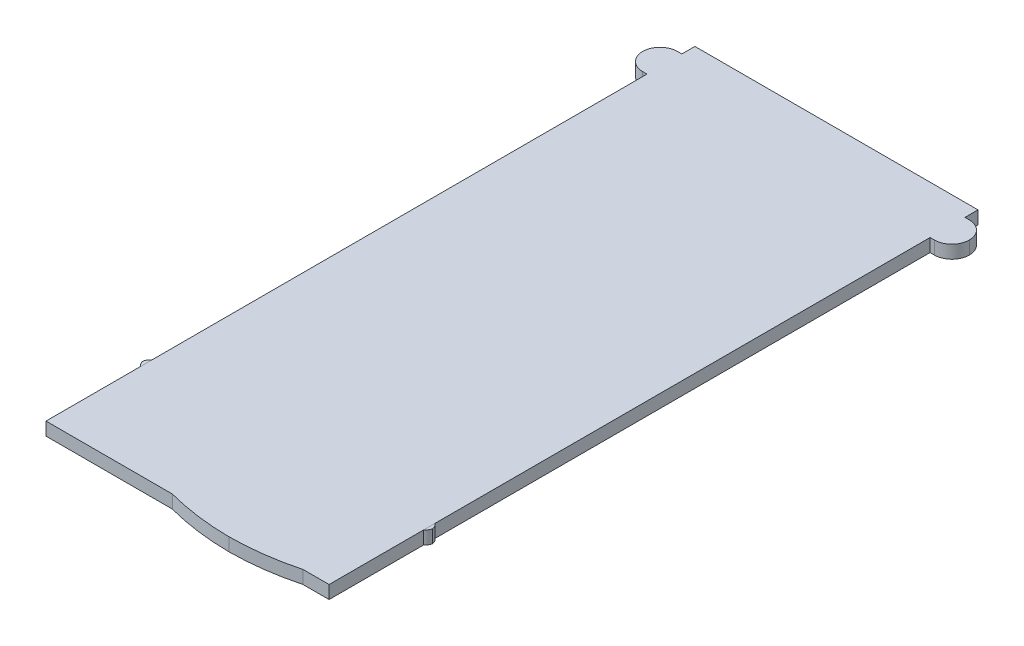
from build123d import *

# Parameters (mm, degrees)
CROQUIS1_W               = 65
CROQUIS1_H               = 146
SALIENTE_EXTRUIR1_DEPTH  = 3
CROQUIS2_W               = 8
CROQUIS2_H               = 3
SALIENTE_EXTRUIR2_DEPTH  = 5
REDONDEO1_R              = 4
REDONDEO1_OF_SIMETR_A1_R = 4
CROQUIS3_W               = 2.60095456
CROQUIS3_H               = 3.001101416
SALIENTE_EXTRUIR3_DEPTH  = 0.8
REDONDEO2_R              = 2
REDONDEO2_OF_SIMETR_A5_R = 2
CROQUIS4_W               = 65
CROQUIS4_H               = 3
CROQUIS4_W_2             = 30
CROQUIS4_H_2             = 2
SALIENTE_EXTRUIR4_DEPTH  = 3
REDONDEO3_R              = 60


# Some blends are built 0.0001 mm under size
with BuildPart() as part:
    # Croquis1 → Saliente-Extruir1 (new body)
    with BuildSketch(Plane(origin=(0, 0, 0), x_dir=(1, 0, 0), z_dir=(0, 1, 0))):
        Rectangle(CROQUIS1_W, CROQUIS1_H)
    extrude(amount=SALIENTE_EXTRUIR1_DEPTH)

    # Croquis2 → Saliente-Extruir2 (add)
    with BuildSketch(Plane(origin=(32.5, 0, 0), x_dir=(0, 0, -1), z_dir=(1, 0, 0))):
        with Locations((66, 1.5)):
            Rectangle(CROQUIS2_W, CROQUIS2_H)
    saliente_extruir2 = extrude(amount=SALIENTE_EXTRUIR2_DEPTH)

    # Redondeo1
    redondeo1_edges = [part.edges().sort_by_distance(p)[0] for p in [
        (37.5, 1.5, -62),
        (37.5, 1.5, -70),
    ]]
    fillet(redondeo1_edges, radius=REDONDEO1_R - 0.0001)  # a hair under: the kernel refuses the full size

    # Simetría1: Saliente-Extruir2 across plane
    add(saliente_extruir2.mirror(Plane(origin=(0, 0, 0), x_dir=(0, 0, 1), z_dir=(1, 0, 0))))

    # Redondeo1 of Simetría1
    redondeo1_of_simetr_a1_edges = [part.edges().sort_by_distance(p)[0] for p in [
        (-37.5, 1.5, -62),
        (-37.5, 1.5, -70),
    ]]
    fillet(redondeo1_of_simetr_a1_edges, radius=REDONDEO1_OF_SIMETR_A1_R - 0.0001)  # a hair under: the kernel refuses the full size

    # Croquis3 → Saliente-Extruir3 (add)
    with BuildSketch(Plane(origin=(32.5, 0, 0), x_dir=(0, 0, -1), z_dir=(1, 0, 0))):
        with Locations((-53.003039433, 1.500550708)):
            Rectangle(CROQUIS3_W, CROQUIS3_H)
    saliente_extruir3 = extrude(amount=SALIENTE_EXTRUIR3_DEPTH)

    # Redondeo2
    # the kernel refuses this fillet: 2 mm, written as the material it takes off along each edge
    with BuildSketch(Plane(origin=(33.3, 7.001101416, 51.702562153), x_dir=(-1, 0, 0), z_dir=(0, -1, 0)), Plane(origin=(33.3, -4, 54.303516713), x_dir=(-1, 0, 0), z_dir=(0, 1, 0))) as redondeo2_piece_1:
        with BuildLine():
            CenterArc((2, -1.6), REDONDEO2_R, 126.869897646, 53.130102354)
            Line((0, -1.6), (-0.04, -1.6))
            Line((-0.04, -1.6), (-0.04, 0))
            Line((-0.04, 0), (0, 0.04))
            ThreePointArc((0, 0.04), (0.4, 0.04), (0.776, 0.032))
            Line((0.776, 0.032), (0.8, 0))
        make_face()
    extrude(amount=11.001101416, mode=Mode.SUBTRACT)

    # Simetría5: Saliente-Extruir3 across plane
    add(saliente_extruir3.mirror(Plane(origin=(0, 0, 0), x_dir=(0, 0, 1), z_dir=(1, 0, 0))))

    # Redondeo2 of Simetría5
    # the kernel refuses this fillet: 2 mm, written as the material it takes off along each edge
    with BuildSketch(Plane(origin=(-33.3, 7.001101416, 51.702562153), x_dir=(1, 0, 0), z_dir=(0, -1, 0)), Plane(origin=(-33.3, -4, 54.303516713), x_dir=(1, 0, 0), z_dir=(0, 1, 0))) as redondeo2_of_simetr_a5_piece_1:
        with BuildLine():
            CenterArc((2, 1.6), REDONDEO2_OF_SIMETR_A5_R, 180, 53.130102354)
            Line((0, 1.6), (-0.04, 1.6))
            Line((-0.04, 1.6), (-0.04, 0))
            Line((-0.04, 0), (0, -0.04))
            ThreePointArc((0, -0.04), (0.4, -0.04), (0.776, -0.032))
            Line((0.776, -0.032), (0.8, 0))
        make_face()
    extrude(amount=11.001101416, mode=Mode.SUBTRACT)

    # Croquis4 → Saliente-Extruir4 (add)
    with BuildSketch(Plane(origin=(0, 3, 0), x_dir=(1, 0, 0), z_dir=(0, 1, 0))):
        with Locations((0, -74.5)):
            Rectangle(CROQUIS4_W, CROQUIS4_H)
        with Locations((11.5, -77)):
            Rectangle(CROQUIS4_W_2, CROQUIS4_H_2)
    extrude(amount=-SALIENTE_EXTRUIR4_DEPTH)

    # Redondeo3
    # the kernel refuses this fillet: 60 mm, written as the material it takes off along each edge
    with BuildSketch(Plane(origin=(26.5, 41.405728739, 78), x_dir=(0, 0, -1), z_dir=(0, -1, 0))) as redondeo3_piece_1:
        with BuildLine():
            CenterArc((60, -15.362291496), REDONDEO3_R, 165.164888418, 14.835111582)
            Line((0, -15.362291496), (0, 0))
            Line((0, 0), (2, 0))
        make_face()
    extrude(amount=79.811457479, mode=Mode.SUBTRACT)
    with BuildSketch(Plane(origin=(-3.5, 41.405728739, 78), x_dir=(1, 0, 0), z_dir=(0, -1, 0))) as redondeo3_piece_2:
        with BuildLine():
            CenterArc((15.362291496, -60), REDONDEO3_R, 90, 14.835111582)
            Line((0, -2), (0, 0))
            Line((0, 0), (15.362291496, 0))
        make_face()
    extrude(amount=79.811457479, mode=Mode.SUBTRACT)


solid = part.part
